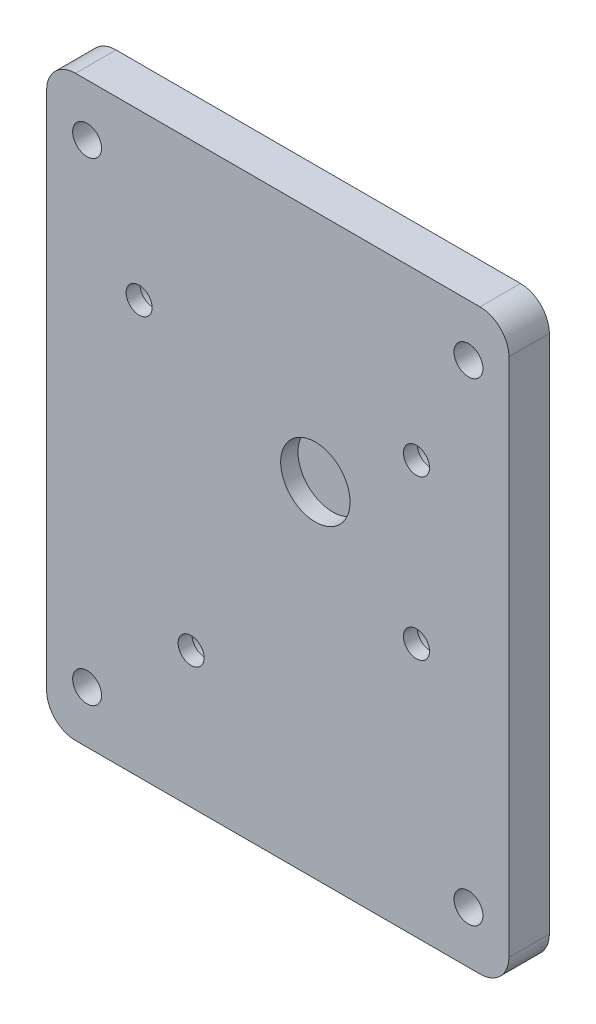
from build123d import *

# Parameters (mm, degrees)
SKETCH_1_W                  = 55
SKETCH_1_H                  = 60
EXTRUDE_1_DEPTH             = 16.5
HOLE_WIZARD_3_6_3_6_1_D     = 3.6
HOLE_WIZARD_3_6_3_6_1_DEPTH = 25
HOLE_WIZARD_3_6_3_6_1_TIP   = 1.081549114
HOLE_WIZARD_M2_5_1_D        = 2.05
HOLE_WIZARD_M2_5_1_DEPTH    = 14
HOLE_WIZARD_M2_5_1_TIP      = 0.615882135
SKETCH_8_W                  = 35
SKETCH_8_H                  = 20.4
CUT_EXTRUDE_1_DEPTH         = 44.914690025
CUT_EXTRUDE_START           = 2.5
SKETCH_9_W                  = 20
SKETCH_9_H                  = 6
CUT_EXTRUDE_2_DEPTH         = 42.414690025
SHELL_START                 = 1.8
SHELL_1_DEPTH               = 14.7
EXTRUDE_2_DEPTH             = 7
SKETCH_16_R                 = 3
CUT_EXTRUDE_4_DEPTH         = 12
CUT_EXTRUDE_5_DEPTH         = 47.120928005
CUT_EXTRUDE_5_DEPTH_BACK    = 47.120928005
SKETCH_17_R                 = 6
FILLET_1_R                  = 0.5
FILLET_2_R                  = 0.5
HOLE_WIZARD_1_AT_2_COUNT    = 2
HOLE_WIZARD_1_AT_2_PITCH    = 27.5
HOLE_WIZARD_1_AT_3_COUNT    = 2
HOLE_WIZARD_1_AT_3_PITCH    = 61.846584384
HOLE_WIZARD_1_AT_4_COUNT    = 2
HOLE_WIZARD_1_AT_4_PITCH    = 48
SKETCH_21_W                 = 80
SKETCH_21_H                 = 100
EXTRUDE_3_DEPTH             = 7
HOLE_WIZARD_2_D             = 4.5
HOLE_WIZARD_2_CBORE_D       = 8
HOLE_WIZARD_2_CBORE_DEPTH   = 4.6
SKETCH_24_R                 = 8.656208536
EXTRUDE_4_DEPTH             = 4
FILLET_3_R                  = 5
HOLE_WIZARD_M6_2_D          = 5
HOLE_WIZARD_M6_2_DEPTH      = 15
HOLE_WIZARD_M6_2_TIP        = 1.502151548


# Read off the part's stored shape, not the designer's step: 抽壳1
with BuildPart() as part:
    # 草图1 → 凸台-拉伸1 (new body)
    with BuildSketch(Plane.XY):
        Rectangle(SKETCH_1_W, SKETCH_1_H)
    extrude(amount=EXTRUDE_1_DEPTH)

    # Ø3.6 (3.6) 直径孔1
    with Locations(Plane.XY.offset(16.5)):
        with Locations((-24, 21.5), (24, 21.5), (24, -6), (-15, -26.5)):
            Hole(HOLE_WIZARD_3_6_3_6_1_D / 2, depth=HOLE_WIZARD_3_6_3_6_1_DEPTH)
            with Locations((0, 0, -(HOLE_WIZARD_3_6_3_6_1_DEPTH + HOLE_WIZARD_3_6_3_6_1_TIP / 2))):  # 118° drill point
                Cone(0, HOLE_WIZARD_3_6_3_6_1_D / 2, HOLE_WIZARD_3_6_3_6_1_TIP, mode=Mode.SUBTRACT)

    # M2.5 螺纹孔1
    with Locations(Plane.XY.offset(16.5)):
        with Locations((-24, 26.5), (24, 26.5), (24, -1), (-22.5, -26.5)):
            Hole(HOLE_WIZARD_M2_5_1_D / 2, depth=HOLE_WIZARD_M2_5_1_DEPTH)
            with Locations((0, 0, -(HOLE_WIZARD_M2_5_1_DEPTH + HOLE_WIZARD_M2_5_1_TIP / 2))):  # 118° drill point
                Cone(0, HOLE_WIZARD_M2_5_1_D / 2, HOLE_WIZARD_M2_5_1_TIP, mode=Mode.SUBTRACT)

    # 草图8 → 切除-拉伸1 (cut, through all)
    with BuildSketch(Plane.XY.offset(16.5)):
        with Locations((10, -19.8)):
            Rectangle(SKETCH_8_W, SKETCH_8_H)
    extrude(amount=-CUT_EXTRUDE_1_DEPTH, mode=Mode.SUBTRACT)

    # 草图9 → 切除-拉伸2 (cut, through all)
    with BuildSketch(Plane(origin=(0, 0, 16.5), x_dir=(-1, 0, 0), z_dir=(0, 0, -1)).offset(CUT_EXTRUDE_START)):
        with Locations((17.5, -27)):
            Rectangle(SKETCH_9_W, SKETCH_9_H)
    extrude(amount=CUT_EXTRUDE_2_DEPTH, mode=Mode.SUBTRACT)

    # 抽壳1 outline → 抽壳1 (cut)
    with BuildSketch(Plane.XY.offset(SHELL_START)):
        with BuildLine():
            ThreePointArc((-21.743758657, 28.2), (-21.182110509, 26.299690696), (-22.006919283, 24.4979375))
            ThreePointArc((-22.006919283, 24.4979375), (-20.910890356, 19.651378458), (-25.7, 18.326673669))
            Line((-25.7, 18.326673669), (-25.7, -22.2))
            Line((-25.7, -22.2), (-9.3, -22.2))
            Line((-9.3, -22.2), (-9.3, -7.8))
            Line((-9.3, -7.8), (20.882308546, -7.8))
            ThreePointArc((20.882308546, -7.8), (20.494996561, -5.178446051), (22.006919283, -3.0020625))
            ThreePointArc((22.006919283, -3.0020625), (21.865811165, 0.8509087), (25.7, 1.256241343))
            Line((25.7, 1.256241343), (25.7, 18.326673669))
            ThreePointArc((25.7, 18.326673669), (20.910890356, 19.651378458), (22.006919283, 24.4979375))
            ThreePointArc((22.006919283, 24.4979375), (21.182110509, 26.299690696), (21.743758657, 28.2))
            Line((21.743758657, 28.2), (-21.743758657, 28.2))
        make_face()
    extrude(amount=SHELL_1_DEPTH, mode=Mode.SUBTRACT)

    # 草图16 → 切除-拉伸4 (cut)
    with BuildSketch(Plane(origin=(-7.5, 0, 0), x_dir=(0, 0, -1), z_dir=(1, 0, 0))):
        with Locations(Location((-8, -18, 0), (0, 0, 90))):
            Circle(SKETCH_16_R)
    extrude(amount=-CUT_EXTRUDE_4_DEPTH, mode=Mode.SUBTRACT)


with BuildPart() as body_2:
    # 草图10 → 凸台-拉伸2 (new body)
    with BuildSketch(Plane.XY.offset(16.5)):
        Polygon((-27.5, -30), (-7.5, -30), (-7.5, -9.6), (27.5, -9.6), (27.5, 30), (-27.5, 30), align=None)
    extrude(amount=EXTRUDE_2_DEPTH)


with BuildPart() as cut_extrude_5_tool:
    # 草图17 → 切除-拉伸5 (new, two sides: drawn at the far end of the back side and taken through both)
    with BuildSketch(Plane.XY.offset(1.8).offset(-CUT_EXTRUDE_5_DEPTH_BACK)):
        with Locations((6.5, 9.5)):
            Circle(SKETCH_17_R)
    extrude(amount=CUT_EXTRUDE_5_DEPTH + CUT_EXTRUDE_5_DEPTH_BACK)


with BuildPart() as part_1:
    add(part.part)

    # 切除-拉伸5: cut by cut_extrude_5_tool
    add(cut_extrude_5_tool.part, mode=Mode.SUBTRACT)

    # 圆角1
    fillet_1_edges = [part_1.edges().sort_by_distance(p)[0] for p in [
        (-27.5, 3, 0),
        (0, 30, 0),
        (27.5, 10.2, 0),
        (27.5, -9.6, 8.25),
        (-7.5, -16.8, 0),
        (10, -9.6, 0),
        (-7.5, -9.6, 8.25),
        (-7.5, -30, 15.25),
        (-27.5, -30, 15.25),
        (-27.5, 30, 8.25),
        (27.5, 30, 8.25),
        (-17.5, -24, 0),
        (-7.5, -24, 7),
        (-27.5, -24, 7),
    ]]
    fillet(fillet_1_edges, radius=FILLET_1_R)


with BuildPart() as body_2_1:
    add(body_2.part)

    # 切除-拉伸5: cut by cut_extrude_5_tool
    add(cut_extrude_5_tool.part, mode=Mode.SUBTRACT)

    # 圆角2
    fillet_2_edges = [body_2_1.edges().sort_by_distance(p)[0] for p in [
        (-27.5, 30, 20),
        (27.5, 30, 20),
        (27.5, -9.6, 20),
        (-7.5, -9.6, 20),
        (-7.5, -30, 20),
        (-27.5, -30, 20),
    ]]
    fillet(fillet_2_edges, radius=FILLET_2_R)

    # 草图20 → 打孔尺寸(%根据)内六角圆柱头螺钉的类型1 (revolve, cut)
    with BuildSketch(Plane(origin=(24, 21.5, 16.5), x_dir=(0, 1, 0), z_dir=(1, 0, 0))):
        Polygon((0, 0), (0, 7), (2.25, 7), (2.25, 4.6), (4, 4.6), (4, 0), align=None)
    hole_wizard_1 = revolve(axis=Axis((24, 21.5, 10.15), (0, 0, 1)), mode=Mode.SUBTRACT)

    # 打孔尺寸(%根据)内六角圆柱头螺钉的类型1 at 2: 打孔尺寸(%根据)内六角圆柱头螺钉的类型1 ×2
    with Locations(*[(0, -i * HOLE_WIZARD_1_AT_2_PITCH, 0) for i in range(1, HOLE_WIZARD_1_AT_2_COUNT)]):
        add(hole_wizard_1, mode=Mode.SUBTRACT)

    # 打孔尺寸(%根据)内六角圆柱头螺钉的类型1 at 3: 打孔尺寸(%根据)内六角圆柱头螺钉的类型1 ×2
    with Locations(*[Vector(-0.6305926250944656, -0.7761140001162656, 0) * (i * HOLE_WIZARD_1_AT_3_PITCH) for i in range(1, HOLE_WIZARD_1_AT_3_COUNT)]):
        add(hole_wizard_1, mode=Mode.SUBTRACT)

    # 打孔尺寸(%根据)内六角圆柱头螺钉的类型1 at 4: 打孔尺寸(%根据)内六角圆柱头螺钉的类型1 ×2
    with Locations(*[(-i * HOLE_WIZARD_1_AT_4_PITCH, 0, 0) for i in range(1, HOLE_WIZARD_1_AT_4_COUNT)]):
        add(hole_wizard_1, mode=Mode.SUBTRACT)

    # 草图21 → 凸台-拉伸3 (add)
    with BuildSketch(Plane.XY.offset(23.5)):
        Rectangle(SKETCH_21_W, SKETCH_21_H)
        with BuildLine():
            Line((-27, -30), (-8, -30))
            ThreePointArc((-8, -30), (-7.646446609, -29.853553391), (-7.5, -29.5))
            Line((-7.5, -29.5), (-7.5, -10.1))
            ThreePointArc((-7.5, -10.1), (-7.353553391, -9.746446609), (-7, -9.6))
            Line((-7, -9.6), (27, -9.6))
            ThreePointArc((27, -9.6), (27.353553391, -9.453553391), (27.5, -9.1))
            Line((27.5, -9.1), (27.5, 29.5))
            ThreePointArc((27.5, 29.5), (27.353553391, 29.853553391), (27, 30))
            Line((27, 30), (-27, 30))
            ThreePointArc((-27, 30), (-27.353553391, 29.853553391), (-27.5, 29.5))
            Line((-27.5, 29.5), (-27.5, -29.5))
            ThreePointArc((-27.5, -29.5), (-27.353553391, -29.853553391), (-27, -30))
        make_face(mode=Mode.SUBTRACT)
    extrude(amount=-EXTRUDE_3_DEPTH)

    # 打孔尺寸(%根据)内六角圆柱头螺钉的类型2 (through all)
    with Locations(Plane(origin=(0, 0, 16.5), x_dir=(-1, 0, 0), z_dir=(0, 0, -1))):
        with Locations((-24, 21.5), (-24, -6), (15, -26.5), (24, 21.5)):
            CounterBoreHole(HOLE_WIZARD_2_D / 2, HOLE_WIZARD_2_CBORE_D / 2, HOLE_WIZARD_2_CBORE_DEPTH)

    # 草图24 → 凸台-拉伸4 (add)
    with BuildSketch(Plane(origin=(0, 0, 16.5), x_dir=(-1, 0, 0), z_dir=(0, 0, -1))):
        with Locations((-6.5, 9.5)):
            Circle(SKETCH_24_R)
    extrude(amount=-EXTRUDE_4_DEPTH)

    # 圆角3
    fillet_3_edges = [body_2_1.edges().sort_by_distance(p)[0] for p in [
        (-40, 50, 20),
        (-40, -50, 20),
        (40, -50, 20),
        (40, 50, 20),
    ]]
    fillet(fillet_3_edges, radius=FILLET_3_R)

    # M6 螺纹孔2
    with Locations(Plane.XY.offset(23.5)):
        with Locations((33, 41), (-33, 41), (-33, -41), (33, -41)):
            Hole(HOLE_WIZARD_M6_2_D / 2, depth=HOLE_WIZARD_M6_2_DEPTH)
            with Locations((0, 0, -(HOLE_WIZARD_M6_2_DEPTH + HOLE_WIZARD_M6_2_TIP / 2))):  # 118° drill point
                Cone(0, HOLE_WIZARD_M6_2_D / 2, HOLE_WIZARD_M6_2_TIP, mode=Mode.SUBTRACT)


solid = body_2_1.part
